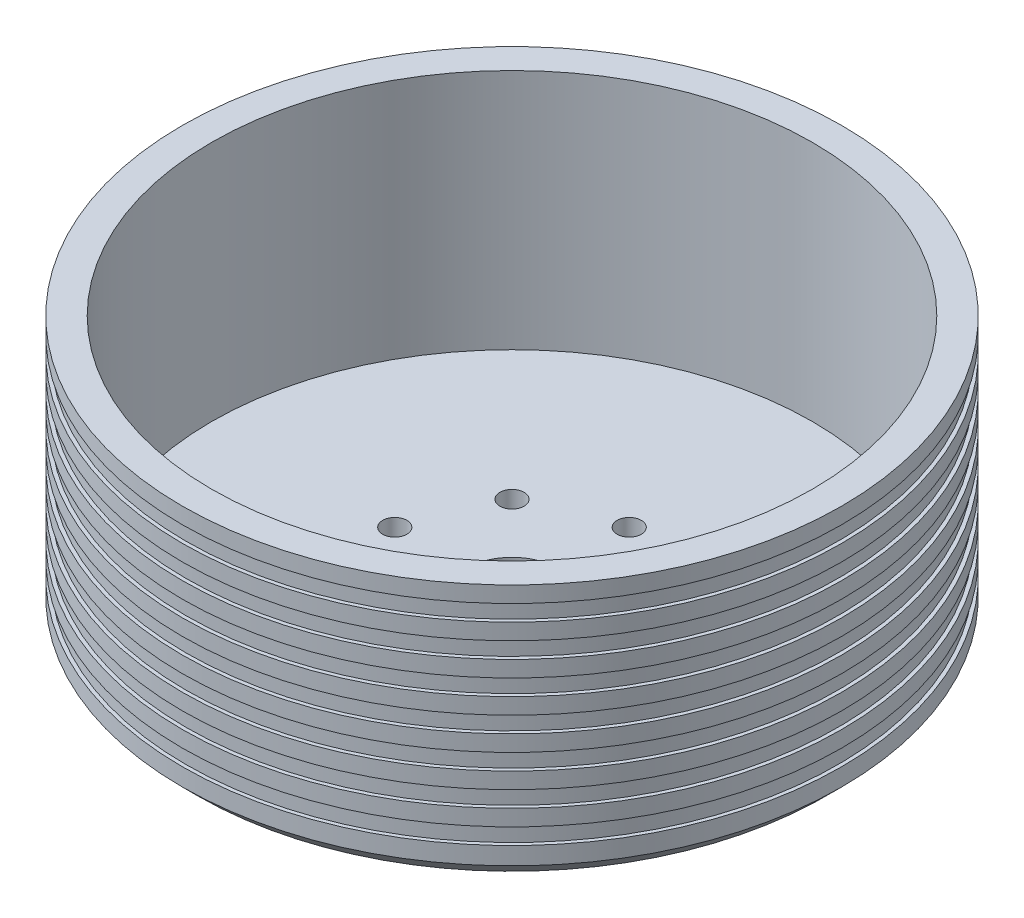
from build123d import *

# Parameters (mm, degrees)
SKETCH1_R           = 45
BOSS_EXTRUDE1_DEPTH = 35.4
SKETCH2_R           = 41
CUT_EXTRUDE1_DEPTH  = 33
SKETCH3_R           = 29.75
BOSS_EXTRUDE2_DEPTH = 2.5
CHAMFER1_SIZE       = 2.5
SKETCH4_R           = 6.3
CUT_EXTRUDE2_DEPTH  = 4.9
SKETCH5_R           = 1.65
CUT_EXTRUDE3_DEPTH  = 4.9
SKETCH7_W           = 0.5
SKETCH7_H           = 2.2
LPATTERN1_COUNT     = 7
LPATTERN1_PITCH     = 4.4
CHAMFER2_SIZE       = 2.2


with BuildPart() as part:
    # Sketch1 → Boss-Extrude1 (new body)
    with BuildSketch(Plane(origin=(0, 0, 0), x_dir=(1, 0, 0), z_dir=(0, 1, 0))):
        with Locations(Location((0, 0, 0), (0, 0, 270))):
            Circle(SKETCH1_R)
    extrude(amount=BOSS_EXTRUDE1_DEPTH)

    # Sketch2 → Cut-Extrude1 (cut)
    with BuildSketch(Plane(origin=(0, 35.4, 0), x_dir=(1, 0, 0), z_dir=(0, 1, 0))):
        with Locations(Location((0, 0, 0), (0, 0, 270))):
            Circle(SKETCH2_R)
    extrude(amount=-CUT_EXTRUDE1_DEPTH, mode=Mode.SUBTRACT)

    # Sketch3 → Boss-Extrude2 (add)
    with BuildSketch(Plane.XZ):
        with Locations(Location((0, 0, 0), (0, 0, 270))):
            Circle(SKETCH3_R)
    extrude(amount=BOSS_EXTRUDE2_DEPTH)

    # Chamfer1
    chamfer1_edges = [part.edges().sort_by_distance(p)[0] for p in [
        (0, -2.5, 29.75),
    ]]
    chamfer(chamfer1_edges, length=CHAMFER1_SIZE - 0.0001)  # a hair under: the kernel refuses the full size

    # Sketch4 → Cut-Extrude2 (cut)
    with BuildSketch(Plane.XZ.offset(2.5)):
        with Locations(Location((0, 0, 0), (0, 0, 270))):
            Circle(SKETCH4_R)
    extrude(amount=-CUT_EXTRUDE2_DEPTH, mode=Mode.SUBTRACT)

    # Sketch5 → Cut-Extrude3 (cut)
    with BuildSketch(Plane.XZ.offset(2.5)):
        with Locations(Location((-16, 0, 0), (0, 0, 270))):
            Circle(SKETCH5_R)
        with Locations(Location((-11.313708499, 11.313708499, 0), (0, 0, 270))):
            Circle(SKETCH5_R)
        with Locations(Location((0, 16, 0), (0, 0, 270))):
            Circle(SKETCH5_R)
        with Locations(Location((11.313708499, 11.313708499, 0), (0, 0, 270))):
            Circle(SKETCH5_R)
        with Locations(Location((16, 0, 0), (0, 0, 270))):
            Circle(SKETCH5_R)
        with Locations(Location((11.313708499, -11.313708499, 0), (0, 0, 270))):
            Circle(SKETCH5_R)
        with Locations(Location((0, -16, 0), (0, 0, 270))):
            Circle(SKETCH5_R)
        with Locations(Location((-11.313708499, -11.313708499, 0), (0, 0, 270))):
            Circle(SKETCH5_R)
    extrude(amount=-CUT_EXTRUDE3_DEPTH, mode=Mode.SUBTRACT)

    # Sketch7 → Cut-Revolve1 (revolve, cut)
    with BuildSketch(Plane(origin=(0, 0, 0), x_dir=(0, 0, -1), z_dir=(1, 0, 0))):
        with Locations((-44.75, 32.1)):
            Rectangle(SKETCH7_W, SKETCH7_H)
    cut_revolve1 = revolve(axis=Axis((0, 35.4, 0), (0, -1, 0)), mode=Mode.SUBTRACT)

    # LPattern1: Cut-Revolve1 ×7
    with Locations(*[(0, -i * LPATTERN1_PITCH, 0) for i in range(1, LPATTERN1_COUNT)]):
        add(cut_revolve1, mode=Mode.SUBTRACT)

    # Chamfer2
    chamfer2_edges = [part.edges().sort_by_distance(p)[0] for p in [
        (0, 0, -45),
    ]]
    chamfer(chamfer2_edges, length=CHAMFER2_SIZE)


solid = part.part
